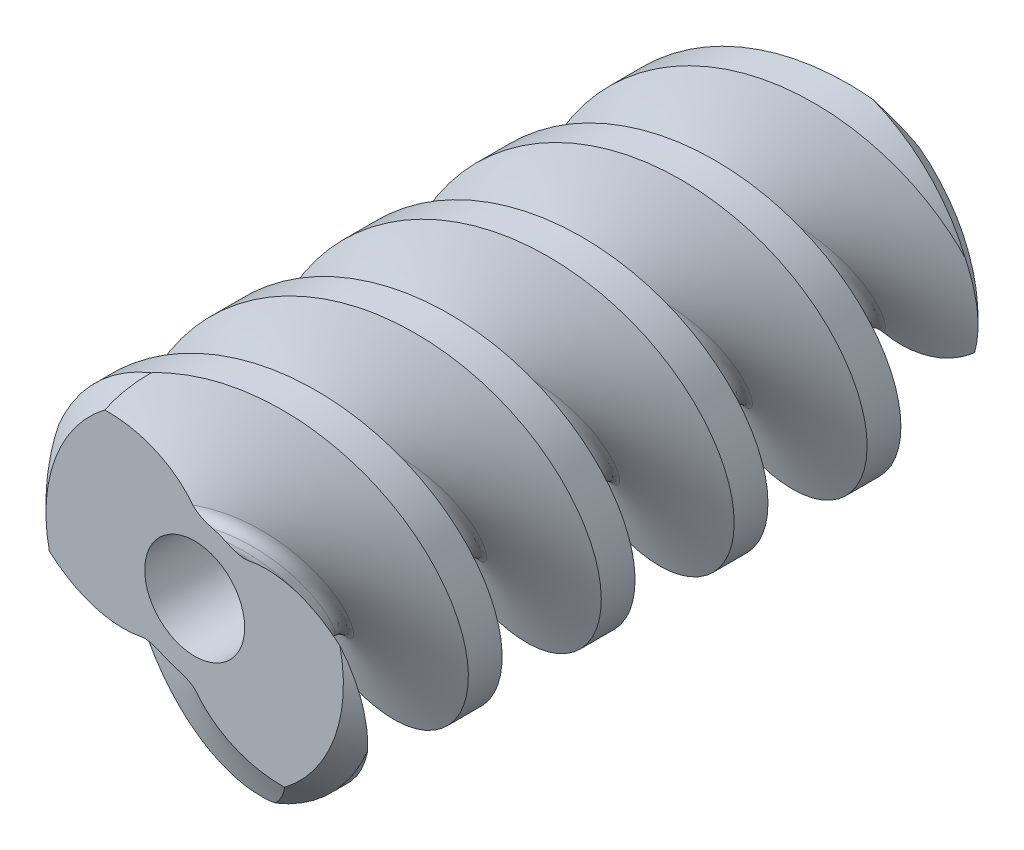
from build123d import *

# Parameters (mm, degrees)
TOOTHCUTWORM01_PITCH      = 15.959290441
PATTERNTHREADWORM01_COUNT = 2
SKETCH7_R                 = 3
CUT_EXTRUDE2_DEPTH        = 41.659724163


with BuildPart() as part:
    # SketchRevolveWorm01 → Worm01 (revolve)
    with BuildSketch(Plane(origin=(0, 0, 0), x_dir=(0, 0, -1), z_dir=(1, 0, 0)), mode=Mode.PRIVATE) as worm01_sk:
        Polygon((19.049999714, 0), (19.049999714, 8.927999962), (17.937999714, 10.039999962), (-17.937999714, 10.039999962), (-19.049999714, 8.927999962), (-19.049999714, 0), align=None)
    revolve(worm01_sk.sketch.rotate(Axis((0, 0, 0), (0, 0, -1)), 90), axis=Axis((0, 0, 0), (0, 0, -1)))

    # ToothCutWorm01: the profile of SketchToothWorm01 screwed along a right-hand helix of 4 turns, 18 arcs to a turn; built about Z, then put on its axis
    toothcutworm01_z = Axis((0, 0, 0), (0, 0, 1))
    toothcutworm01_corners = [(10.674999952, 0, 3.221049397), (4.812486137, 0, 0.957033141), (4.325000048, 0, 0.246198349), (4.325000048, 0, -0.246198349), (4.812486137, 0, -0.957033141), (10.674999952, 0, -3.221049397)]
    with BuildLine(mode=Mode.PRIVATE) as toothcutworm01_profile:
        Line(toothcutworm01_corners[0], toothcutworm01_corners[1])
        Line(toothcutworm01_corners[2], toothcutworm01_corners[3])
        Line(toothcutworm01_corners[4], toothcutworm01_corners[5])
        Line(toothcutworm01_corners[5], toothcutworm01_corners[0])
        ThreePointArc((4.812486137, 0, 0.957033141), (4.458579966, 0, 0.677164934), (4.325000048, 0, 0.246198349))
        ThreePointArc((4.325000048, 0, -0.246198349), (4.458579966, 0, -0.677164934), (4.812486137, 0, -0.957033141))
    toothcutworm01_cap = Face(toothcutworm01_profile.wire())
    toothcutworm01_arcs = [((4.812486137, 0, 0.957033141), (4.325000048, 0, 0.768773213), (4.325000048, 0, 0.246198349), (1, 0.8246982678514461, 1)), ((4.325000048, 0, -0.246198349), (4.325000048, 0, -0.768773213), (4.812486137, 0, -0.957033141), (1, 0.8246982678514301, 1))]  # start, shoulder, end, weights
    toothcutworm01_turn_angles = [0, 10, 20, 30, 40, 50, 60, 70, 80, 90, 100, 110, 120, 130, 140, 150, 160, 170, 180, 190, 200, 210, 220, 230, 240, 250, 260, 270, 280, 290, 300, 310, 320, 330, 340, 350, 360]
    toothcutworm01_turn_weights = [1, 0.984807753012208, 1, 0.984807753012208, 1, 0.984807753012208, 1, 0.984807753012208, 1, 0.984807753012208, 1, 0.984807753012208, 1, 0.984807753012208, 1, 0.984807753012208, 1, 0.984807753012208, 1, 0.984807753012208, 1, 0.984807753012208, 1, 0.984807753012208, 1, 0.984807753012208, 1, 0.984807753012208, 1, 0.984807753012208, 1, 0.984807753012208, 1, 0.984807753012208, 1, 0.984807753012208, 1]
    toothcutworm01_turn_rails = [Edge.make_bspline([Vector(p[0], p[1], 0).rotate(toothcutworm01_z, toothcutworm01_turn_angles[k]) / toothcutworm01_turn_weights[k] + Vector(0, 0, p[2] + TOOTHCUTWORM01_PITCH * toothcutworm01_turn_angles[k] / 360) for k in range(37)], [0, 0, 0, 1, 1, 2, 2, 3, 3, 4, 4, 5, 5, 6, 6, 7, 7, 8, 8, 9, 9, 10, 10, 11, 11, 12, 12, 13, 13, 14, 14, 15, 15, 16, 16, 17, 17, 18, 18, 18], 2, toothcutworm01_turn_weights) for p in toothcutworm01_corners]
    toothcutworm01_turn_sides = [*[Face.make_surface_from_curves(toothcutworm01_turn_rails[p[0]], toothcutworm01_turn_rails[p[1]]) for p in [(0, 1), (2, 3), (4, 5), (5, 0)]], *[Face.make_bezier_surface([[Vector(p[j][0], p[j][1], 0).rotate(toothcutworm01_z, toothcutworm01_turn_angles[2 * i + k]) / toothcutworm01_turn_weights[2 * i + k] + Vector(0, 0, p[j][2] + TOOTHCUTWORM01_PITCH * toothcutworm01_turn_angles[2 * i + k] / 360) for k in range(3)] for j in range(3)], [[p[3][j] * toothcutworm01_turn_weights[2 * i + k] for k in range(3)] for j in range(3)]) for p in toothcutworm01_arcs for i in range(18)]]
    toothcutworm01 = Plane(origin=(0, 0, 31.918580881), x_dir=(1, 0, 0), z_dir=(0, 0, -1)) * Solid(Shell([*[p.moved(Location((0, 0, TOOTHCUTWORM01_PITCH * i))) for i in range(4) for p in toothcutworm01_turn_sides], toothcutworm01_cap, toothcutworm01_cap.rotate(toothcutworm01_z, 1440).moved(Location((0, 0, TOOTHCUTWORM01_PITCH * 1440 / 360)))]))
    add(toothcutworm01, mode=Mode.SUBTRACT)

    # PatternThreadWorm01: ToothCutWorm01 ×2 about axis
    patternthreadworm01_axis = Axis((0, 0, 50), (0, 0, -1))
    for i in range(1, PATTERNTHREADWORM01_COUNT):
        add(toothcutworm01.rotate(patternthreadworm01_axis, i * 360 / PATTERNTHREADWORM01_COUNT), mode=Mode.SUBTRACT)

    # Sketch7 → Cut-Extrude2 (cut, through all)
    with BuildSketch(Plane.XY.offset(19.049999714)):
        Circle(SKETCH7_R)
    extrude(amount=-CUT_EXTRUDE2_DEPTH, mode=Mode.SUBTRACT)


solid = part.part
